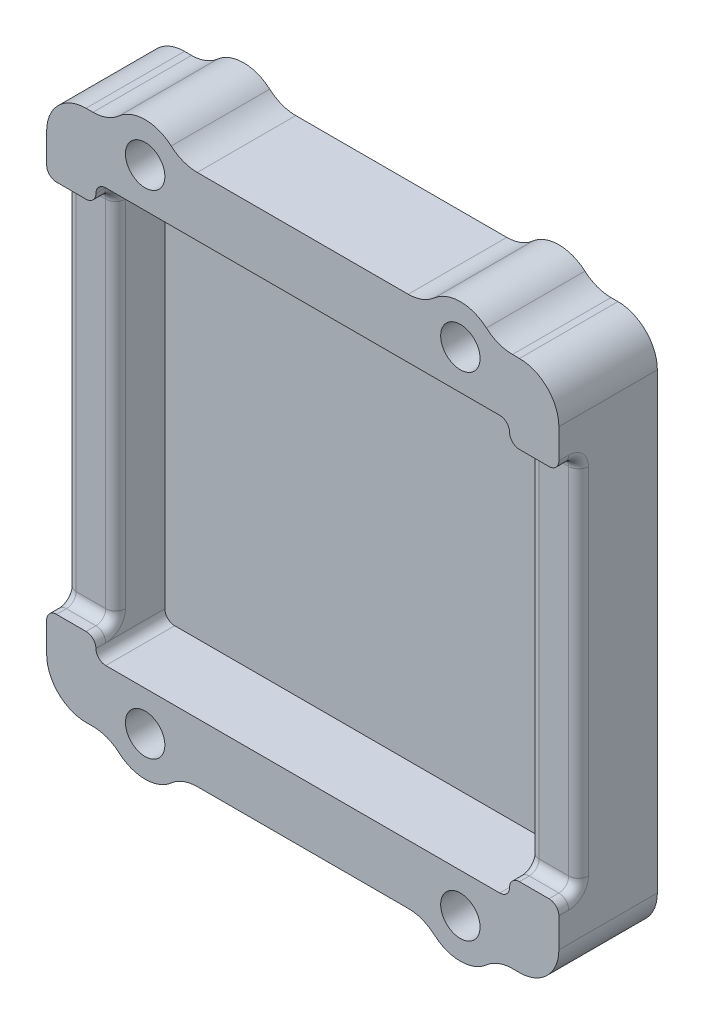
from build123d import *

# Parameters (mm, degrees)
ESQUISSE1_R             = 1
ESQUISSE1_W             = 21
ESQUISSE1_H             = 21
BOSS_EXTRU_1_DEPTH      = 5
ESQUISSE2_W             = 21
ESQUISSE2_H             = 21
BOSS_EXTRU_2_DEPTH      = 1.5
ESQUISSE3_W             = 2.5
ESQUISSE3_H             = 19
ENL_V_MAT_EXTRU_1_DEPTH = 1
CONG_1_R                = 2
CONG_2_R                = 2
CONG_3_R                = 0.5


with BuildPart() as part:
    # Esquisse1 → Boss.-Extru.1 (new body)
    with BuildSketch(Plane.XY):
        with BuildLine():
            Line((13, 13.5), (9.732050808, 13.5))
            ThreePointArc((9.732050808, 13.5), (8, 14.5), (6.267949192, 13.5))
            Line((6.267949192, 13.5), (-6.267949192, 13.5))
            ThreePointArc((-6.267949192, 13.5), (-8, 14.5), (-9.732050808, 13.5))
            Line((-9.732050808, 13.5), (-13, 13.5))
            Line((-13, 13.5), (-13, -13.5))
            Line((-13, -13.5), (-9.732050808, -13.5))
            ThreePointArc((-9.732050808, -13.5), (-8, -14.5), (-6.267949192, -13.5))
            Line((-6.267949192, -13.5), (6.267949192, -13.5))
            ThreePointArc((6.267949192, -13.5), (8, -14.5), (9.732050808, -13.5))
            Line((9.732050808, -13.5), (13, -13.5))
            Line((13, -13.5), (13, 13.5))
        make_face()
        with Locations((-8, 12.5)):
            Circle(ESQUISSE1_R, mode=Mode.SUBTRACT)
        with Locations(Location((8, 12.5, 0), (0, 0, 180))):
            Circle(ESQUISSE1_R, mode=Mode.SUBTRACT)
        with Locations((8, -12.5)):
            Circle(ESQUISSE1_R, mode=Mode.SUBTRACT)
        with Locations(Location((-8, -12.5, 0), (0, 0, 180))):
            Circle(ESQUISSE1_R, mode=Mode.SUBTRACT)
        Rectangle(ESQUISSE1_W, ESQUISSE1_H, mode=Mode.SUBTRACT)
    extrude(amount=BOSS_EXTRU_1_DEPTH)

    # Esquisse2 → Boss.-Extru.2 (add)
    with BuildSketch(Plane(origin=(0, 0, 0), x_dir=(-1, 0, 0), z_dir=(0, 0, -1))):
        Rectangle(ESQUISSE2_W, ESQUISSE2_H)
    extrude(amount=-BOSS_EXTRU_2_DEPTH)

    # Esquisse3 → Enlèv. mat.-Extru.1 (cut)
    with BuildSketch(Plane.XY.offset(5)):
        with Locations((-11.75, 0)):
            Rectangle(ESQUISSE3_W, ESQUISSE3_H)
        with Locations((11.75, 0)):
            Rectangle(ESQUISSE3_W, ESQUISSE3_H)
    extrude(amount=-ENL_V_MAT_EXTRU_1_DEPTH, mode=Mode.SUBTRACT)

    # Congé1
    cong_1_edges = [part.edges().sort_by_distance(p)[0] for p in [
        (-13, -13.5, 2.5),
        (-13, 13.5, 2.5),
        (13, 13.5, 2.5),
        (13, -13.5, 2.5),
    ]]
    fillet(cong_1_edges, radius=CONG_1_R)

    # Congé2
    cong_2_edges = [part.edges().sort_by_distance(p)[0] for p in [
        (-9.732050808, 13.5, 2.5),
        (-6.267949192, 13.5, 2.5),
        (6.267949192, 13.5, 2.5),
        (9.732050808, 13.5, 2.5),
        (9.732050808, -13.5, 2.5),
        (6.267949192, -13.5, 2.5),
        (-6.267949192, -13.5, 2.5),
        (-9.732050808, -13.5, 2.5),
    ]]
    fillet(cong_2_edges, radius=CONG_2_R)

    # Congé3
    cong_3_edges = [part.edges().sort_by_distance(p)[0] for p in [
        (13, -9.5, 4.5),
        (-13, 9.5, 4.5),
        (-13, -9.5, 4.5),
        (-10.5, -9.5, 4.5),
        (-10.5, 9.5, 4.5),
        (10.5, 9.5, 4.5),
        (10.5, -9.5, 4.5),
        (13, 0, 4),
        (-13, 0, 4),
        (-10.5, 0, 4),
        (10.5, 0, 4),
        (13, 9.5, 4.5),
        (11.75, -9.5, 4),
        (11.75, 9.5, 4),
        (-11.75, 9.5, 4),
        (-11.75, -9.5, 4),
        (-10.5, -10.5, 3.25),
        (10.5, -10.5, 3.25),
        (10.5, 10.5, 3.25),
        (-10.5, 10.5, 3.25),
    ]]
    fillet(cong_3_edges, radius=CONG_3_R - 0.0001)  # a hair under: the kernel refuses the full size


solid = part.part
